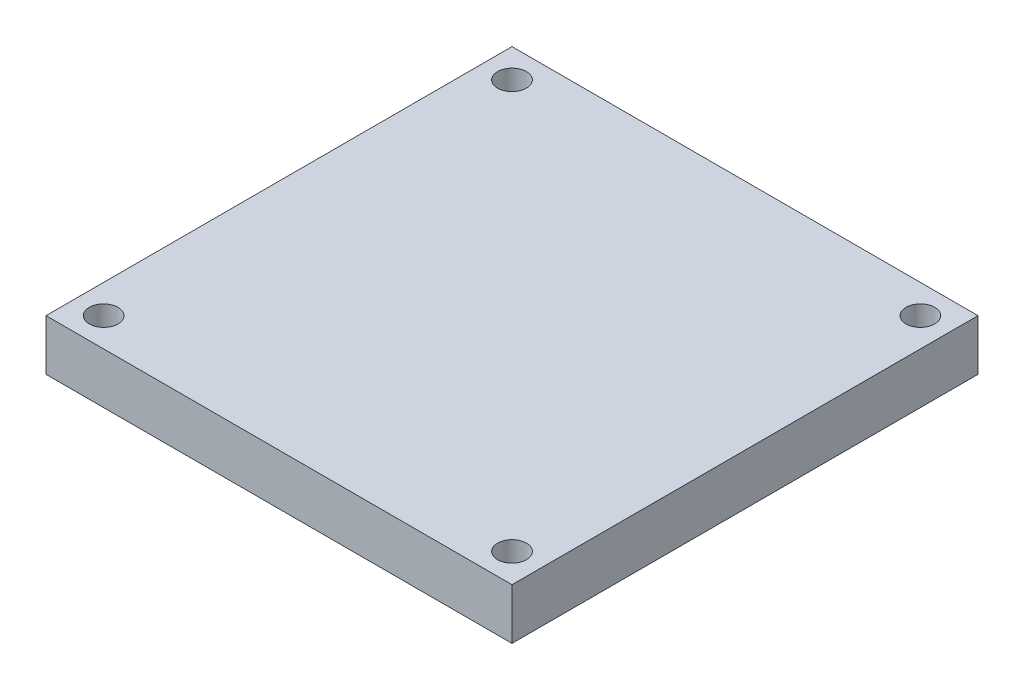
from build123d import *

# Parameters (mm, degrees)
SKETCH1_W            = 54.99
SKETCH1_H            = 54.99
BOSS_EXTRUDE1_DEPTH  = 6
M3_CLEARANCE_HOLE2_D = 3.4


with BuildPart() as part:
    # Sketch1 → Boss-Extrude1 (new body)
    with BuildSketch(Plane(origin=(0, 0, 0), x_dir=(1, 0, 0), z_dir=(0, 1, 0))):
        Rectangle(SKETCH1_W, SKETCH1_H)
    extrude(amount=BOSS_EXTRUDE1_DEPTH)

    # M3 Clearance Hole2 (through all)
    with Locations(Plane(origin=(0, 6, 0), x_dir=(1, 0, 0), z_dir=(0, 1, 0))):
        with Locations((-24.095, 24.095), (24.095, 24.095), (24.095, -24.095), (-24.095, -24.095)):
            Hole(M3_CLEARANCE_HOLE2_D / 2)


solid = part.part
